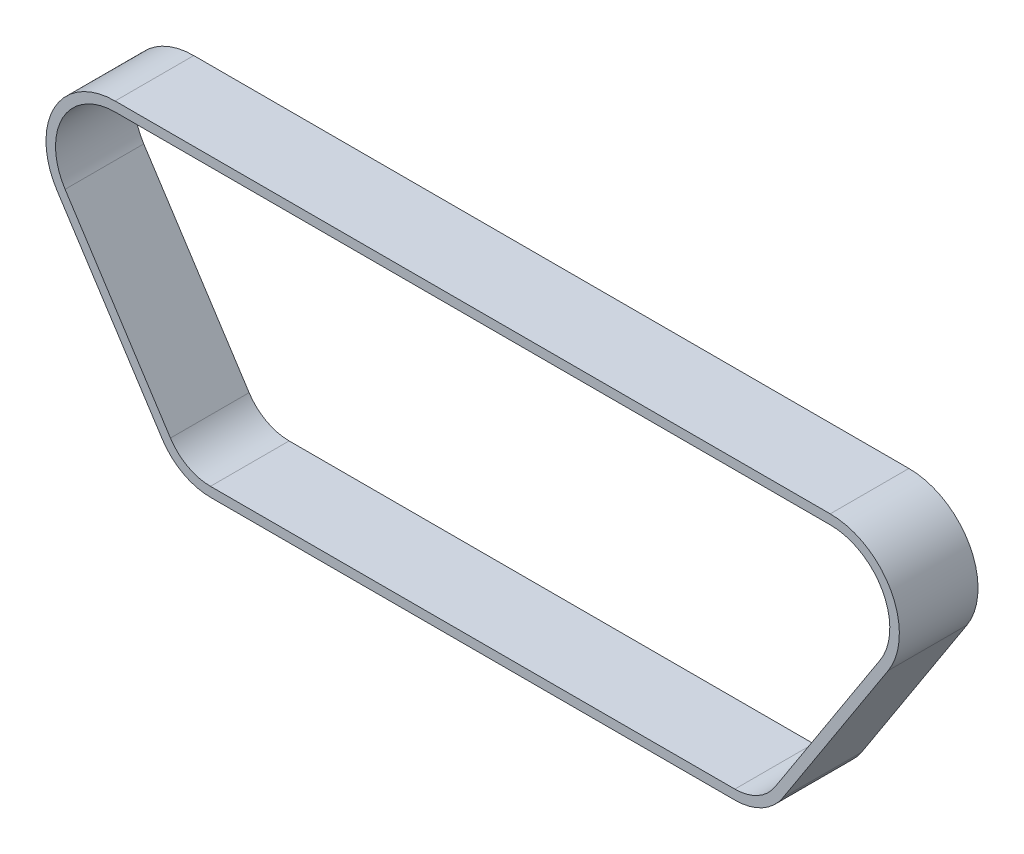
from build123d import *

# Parameters (mm, degrees)
BOSS_EXTRUDE1_DEPTH = 8.25


with BuildPart() as part:
    # Sketch1 → Boss-Extrude1 (new, symmetric)
    with BuildSketch(Plane.XY):
        with BuildLine():
            Line((-130, -47.5), (-20, -47.5))
            ThreePointArc((-20, -47.5), (-14.266151734, -46.041488703), (-9.926117214, -42.020497344))
            Line((-9.926117214, -42.020497344), (12.172608366, -7.878934291))
            ThreePointArc((12.172608366, -7.878934291), (12.737632182, 6.928399988), (0, 14.5))
            Line((0, 14.5), (-150, 14.5))
            ThreePointArc((-150, 14.5), (-162.737632182, 6.928399988), (-162.172608366, -7.878934291))
            Line((-162.172608366, -7.878934291), (-140.073882786, -42.020497344))
            ThreePointArc((-140.073882786, -42.020497344), (-135.733848266, -46.041488703), (-130, -47.5))
        make_face()
        with BuildLine():
            Line((-150, 12.5), (0, 12.5))
            ThreePointArc((0, 12.5), (10.980717398, 5.97275861), (10.493627902, -6.792184734))
            Line((10.493627902, -6.792184734), (-11.605097678, -40.933747787))
            ThreePointArc((-11.605097678, -40.933747787), (-15.221793112, -44.284573919), (-20, -45.5))
            Line((-20, -45.5), (-130, -45.5))
            ThreePointArc((-130, -45.5), (-134.778206888, -44.284573919), (-138.394902322, -40.933747787))
            Line((-138.394902322, -40.933747787), (-160.493627902, -6.792184734))
            ThreePointArc((-160.493627902, -6.792184734), (-160.980717398, 5.97275861), (-150, 12.5))
        make_face(mode=Mode.SUBTRACT)
    extrude(amount=BOSS_EXTRUDE1_DEPTH, both=True)


solid = part.part
